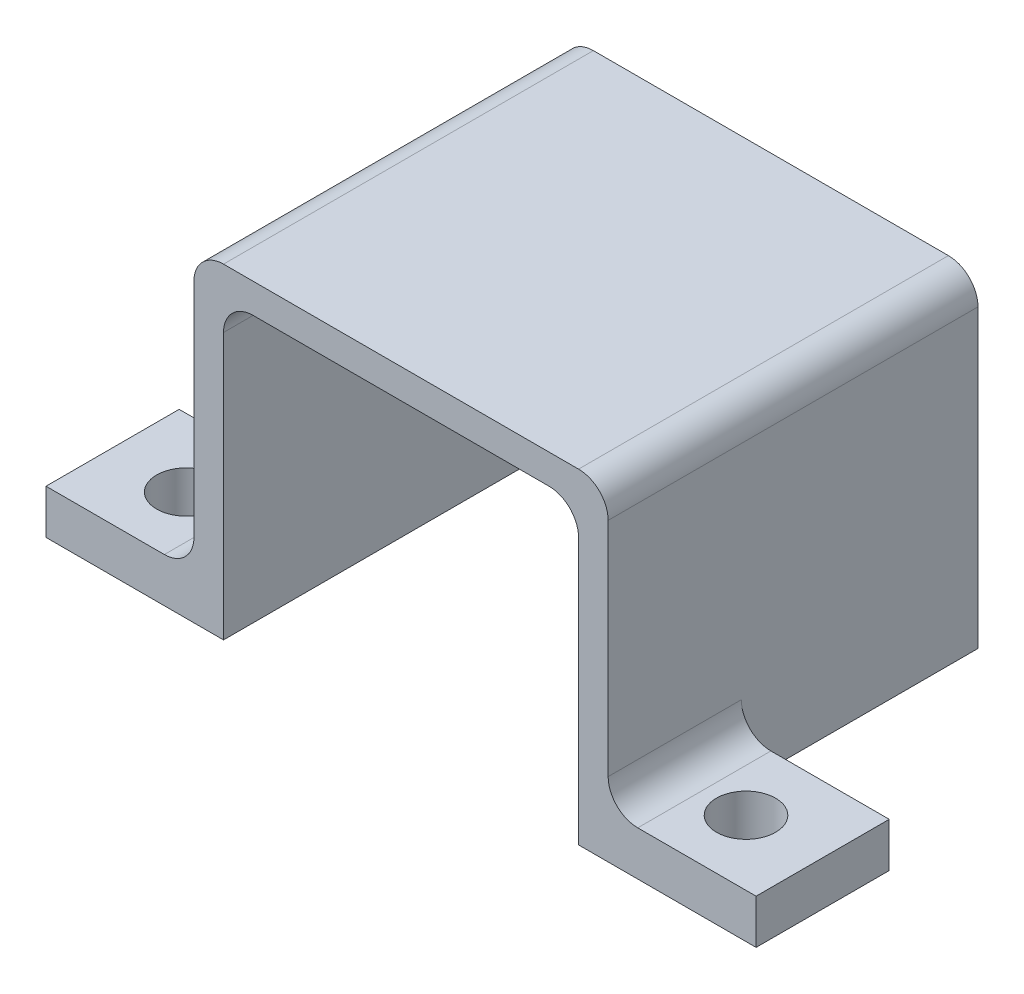
from build123d import *

# Parameters (mm, degrees)
BOSS_EXTRUDE1_DEPTH = 12.5
SKETCH3_R           = 1
CUT_EXTRUDE1_DEPTH  = 49.99745314
FILLET1_R           = 1
SKETCH4_W           = 12
SKETCH4_H           = 2.4
BOSS_EXTRUDE2_DEPTH = 1
CAVITY2_START       = 28.390407362
CAVITY2_DEPTH       = 2.4
FILLET2_R           = 1
SKETCH5_W           = 5
SKETCH5_H           = 8
CUT_EXTRUDE2_DEPTH  = 49.99745314
FILLET3_R           = 1


# Read off the part's stored shape, not the designer's step: Cavity2
with BuildPart() as part:
    # Sketch2 → Boss-Extrude1 (new body)
    with BuildSketch(Plane.XY.offset(40.090407362)):
        Polygon((8.51904319, 15.222118346), (8.51904319, 25.222118346), (20.51904319, 25.222118346), (20.51904319, 15.222118346), (21.51904319, 15.222118346), (26.51904319, 15.222118346), (26.51904319, 16.722118346), (21.51904319, 16.722118346), (21.51904319, 26.222118346), (7.51904319, 26.222118346), (7.51904319, 16.722118346), (2.51904319, 16.722118346), (2.51904319, 15.222118346), (7.51904319, 15.222118346), align=None)
    extrude(amount=-BOSS_EXTRUDE1_DEPTH)

    # Sketch3 → Cut-Extrude1 (cut, through all)
    with BuildSketch(Plane(origin=(0, 16.722118346, 0), x_dir=(1, 0, 0), z_dir=(0, 1, 0))):
        with Locations(Location((5.05904319, -37.891330821, 0), (0, 0, 270))):
            Circle(SKETCH3_R)
        with Locations(Location((23.97904319, -37.891330821, 0), (0, 0, 270))):
            Circle(SKETCH3_R)
    extrude(amount=-CUT_EXTRUDE1_DEPTH, mode=Mode.SUBTRACT)

    # Fillet1
    fillet1_edges = [part.edges().sort_by_distance(p)[0] for p in [
        (8.51904319, 25.222118346, 33.840407362),
        (20.51904319, 25.222118346, 33.840407362),
    ]]
    fillet(fillet1_edges, radius=FILLET1_R)

    # Sketch4 → Boss-Extrude2 (add)
    with BuildSketch(Plane.XZ.offset(-25.222118346)):
        with Locations((14.51904319, 29.590407362)):
            Rectangle(SKETCH4_W, SKETCH4_H)
    extrude(amount=BOSS_EXTRUDE2_DEPTH)

    # Cavity2 outline → Cavity2 (cut)
    with BuildSketch(Plane.XY.offset(CAVITY2_START)):
        with BuildLine():
            Line((17.186568025, 24.222118346), (19.451518355, 24.222118346))
            ThreePointArc((19.451518355, 24.222118346), (18.31904319, 24.672118346), (17.186568025, 24.222118346))
        make_face()
    extrude(amount=CAVITY2_DEPTH, mode=Mode.SUBTRACT)

    # Fillet2
    fillet2_edges = [part.edges().sort_by_distance(p)[0] for p in [
        (21.51904319, 26.222118346, 33.840407362),
        (7.51904319, 26.222118346, 33.840407362),
    ]]
    fillet(fillet2_edges, radius=FILLET2_R)

    # Sketch5 → Cut-Extrude2 (cut, through all)
    with BuildSketch(Plane(origin=(0, 16.722118346, 0), x_dir=(1, 0, 0), z_dir=(0, 1, 0))):
        with Locations((5.01904319, -31.590407362)):
            Rectangle(SKETCH5_W, SKETCH5_H)
        with Locations((24.01904319, -31.590407362)):
            Rectangle(SKETCH5_W, SKETCH5_H)
    extrude(amount=-CUT_EXTRUDE2_DEPTH, mode=Mode.SUBTRACT)

    # Fillet3
    fillet3_edges = [part.edges().sort_by_distance(p)[0] for p in [
        (21.51904319, 16.722118346, 37.840407362),
        (7.51904319, 16.722118346, 37.840407362),
    ]]
    fillet(fillet3_edges, radius=FILLET3_R)


solid = part.part
